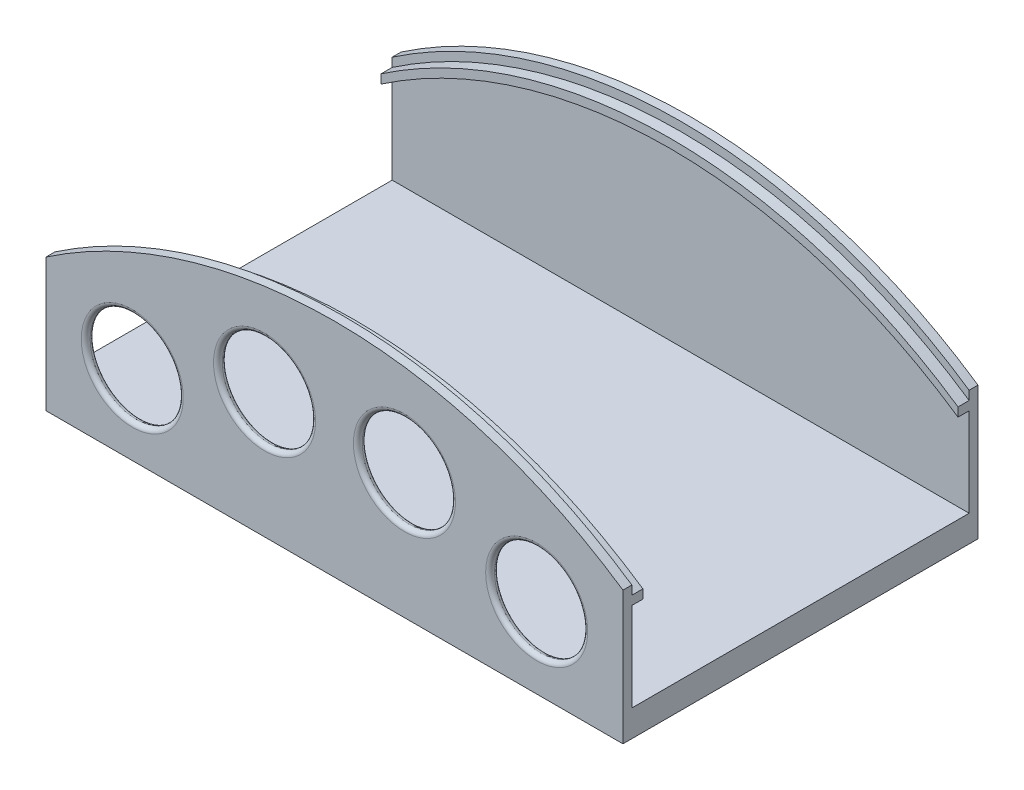
from build123d import *

# Parameters (mm, degrees)
EXTRUDE_1_DEPTH     = 80
SKETCH_3_W          = 76
SKETCH_3_H          = 50.566144797
CUT_EXTRUDE_1_DEPTH = 161.623784042
SKETCH_4_R          = 10.5
CUT_EXTRUDE_2_DEPTH = 2
SKETCH_5_W          = 7
SKETCH_5_H          = 52
CUT_EXTRUDE_3_DEPTH = 3.2
FILLET_4_R          = 1
EXTRUDE_2_DEPTH     = 2.5
EXTRUDE_START       = 2.5
EXTRUDE_3_DEPTH     = 2.5


with BuildPart() as part:
    # Эскиз2 → Бобышка-Вытянуть1 (new body)
    with BuildSketch(Plane.XY):
        with BuildLine():
            Line((0, 0), (130, 0))
            Line((130, 0), (130, 30))
            ThreePointArc((130, 30), (65, 50), (0, 30))
            Line((0, 30), (0, 0))
        make_face()
    extrude(amount=EXTRUDE_1_DEPTH)

    # Эскиз3 → Вырез-Вытянуть1 (cut, through all)
    with BuildSketch(Plane(origin=(130, 0, 0), x_dir=(0, 0, -1), z_dir=(1, 0, 0))):
        with Locations((-40, 31.283072399)):
            Rectangle(SKETCH_3_W, SKETCH_3_H)
    extrude(amount=-CUT_EXTRUDE_1_DEPTH, mode=Mode.SUBTRACT)

    # Эскиз4 → Вырез-Вытянуть2 (cut)
    with BuildSketch(Plane.XY.offset(80)):
        with Locations((19.439269404, 18)):
            Circle(SKETCH_4_R)
        with Locations((49.237283637, 28.292291115)):
            Circle(SKETCH_4_R)
        with Locations((80.762716363, 28.292291115)):
            Circle(SKETCH_4_R)
        with Locations((110.560730596, 18)):
            Circle(SKETCH_4_R)
    extrude(amount=-CUT_EXTRUDE_2_DEPTH, mode=Mode.SUBTRACT)

    # Эскиз5 → Вырез-Вытянуть3 (cut)
    with BuildSketch(Plane.XZ):
        with Locations((18.5, 40)):
            Rectangle(SKETCH_5_W, SKETCH_5_H)
        with Locations((111.5, 40)):
            Rectangle(SKETCH_5_W, SKETCH_5_H)
    extrude(amount=-CUT_EXTRUDE_3_DEPTH, mode=Mode.SUBTRACT)

    # Скругление4
    fillet_4_edges = [part.edges().sort_by_distance(p)[0] for p in [
        (8.939269404, 18, 80),
        (8.939269404, 18, 78),
        (38.737283637, 28.292291115, 80),
        (38.737283637, 28.292291115, 78),
        (70.262716363, 28.292291115, 80),
        (70.262716363, 28.292291115, 78),
        (100.060730596, 18, 80),
        (100.060730596, 18, 78),
    ]]
    fillet(fillet_4_edges, radius=FILLET_4_R - 0.0001)  # a hair under: the kernel refuses the full size

    # Эскиз7 → Бобышка-Вытянуть2 (add)
    with BuildSketch(Plane(origin=(0, 0, 78), x_dir=(-1, 0, 0), z_dir=(0, 0, -1))):
        with BuildLine():
            Line((0, 26), (0, 28))
            ThreePointArc((0, 28), (-65, 48), (-130, 28))
            Line((-130, 28), (-130, 26))
            ThreePointArc((-130, 26), (-65, 46), (0, 26))
        make_face()
    extrude(amount=EXTRUDE_2_DEPTH)

    # Эскиз9 → Бобышка-Вытянуть3 (add)
    with BuildSketch(Plane.XY.offset(2).offset(EXTRUDE_START)):
        with BuildLine():
            Line((0, 26), (0, 28))
            ThreePointArc((0, 28), (65, 48), (130, 28))
            Line((130, 28), (130, 26))
            ThreePointArc((130, 26), (65, 46), (0, 26))
        make_face()
    extrude(amount=-EXTRUDE_3_DEPTH)


solid = part.part
